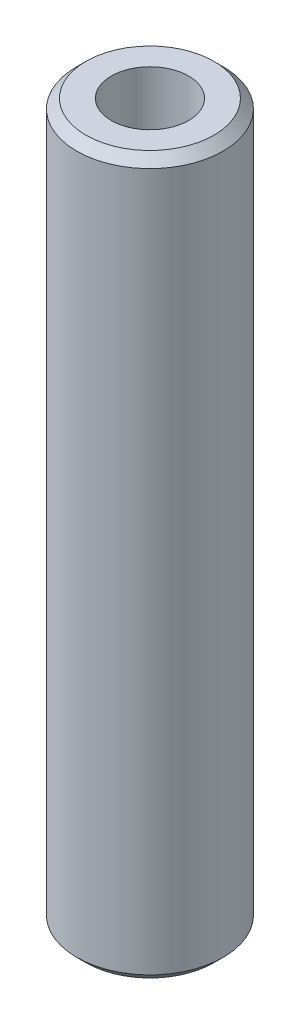
from build123d import *

# Parameters (mm, degrees)
SKETCH1_R           = 10
BOSS_EXTRUDE1_DEPTH = 97.881521679
SKETCH2_R           = 5.274678352
CUT_EXTRUDE1_DEPTH  = 99.897888179
CHAMFER1_SIZE       = 1.257068992


with BuildPart() as part:
    # Sketch1 → Boss-Extrude1 (new body)
    with BuildSketch(Plane(origin=(0, 0, 0), x_dir=(1, 0, 0), z_dir=(0, 1, 0))):
        Circle(SKETCH1_R)
    extrude(amount=BOSS_EXTRUDE1_DEPTH)

    # Sketch2 → Cut-Extrude1 (cut, through all)
    with BuildSketch(Plane(origin=(0, 0, 0), x_dir=(1, 0, 0), z_dir=(0, 1, 0))):
        Circle(SKETCH2_R)
    extrude(amount=CUT_EXTRUDE1_DEPTH, mode=Mode.SUBTRACT)

    # Chamfer1
    chamfer1_edges = [part.edges().sort_by_distance(p)[0] for p in [
        (-10, 97.881521679, 0),
        (-10, 0, 0),
    ]]
    chamfer(chamfer1_edges, length=CHAMFER1_SIZE)


solid = part.part
